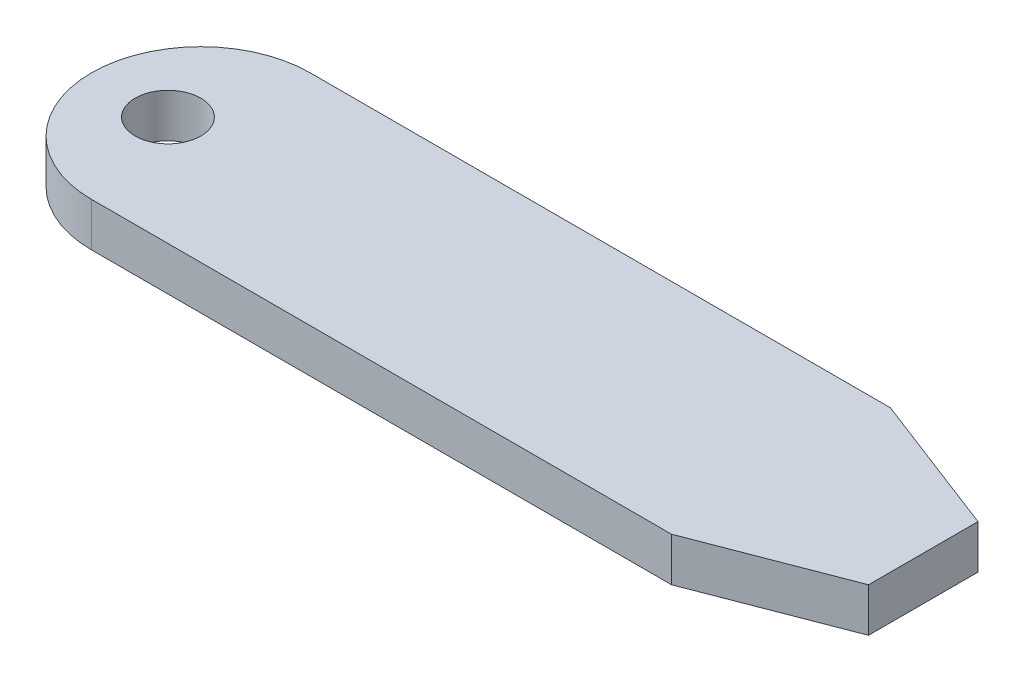
from build123d import *

# Parameters (mm, degrees)
CROQUIS1_R              = 1.5
SALIENTE_EXTRUIR1_DEPTH = 2
REDONDEO1_R             = 5


with BuildPart() as part:
    # Croquis1 → Saliente-Extruir1 (new body)
    with BuildSketch(Plane(origin=(0, 0, 0), x_dir=(1, 0, 0), z_dir=(0, 1, 0))):
        Polygon((-13, 0), (-13, 5), (0, 5), (18.5, 5), (25, 2.5), (25, 0), (25, -2.5), (18.5, -5), (0, -5), (-13, -5), align=None)
        with Locations(Location((-9.5, 0, 0), (0, 0, 270))):
            Circle(CROQUIS1_R, mode=Mode.SUBTRACT)
    extrude(amount=SALIENTE_EXTRUIR1_DEPTH)

    # Redondeo1
    redondeo1_edges = [part.edges().sort_by_distance(p)[0] for p in [
        (-13, 1, 5),
        (-13, 1, -5),
    ]]
    fillet(redondeo1_edges, radius=REDONDEO1_R - 0.0001)  # a hair under: the kernel refuses the full size


solid = part.part
